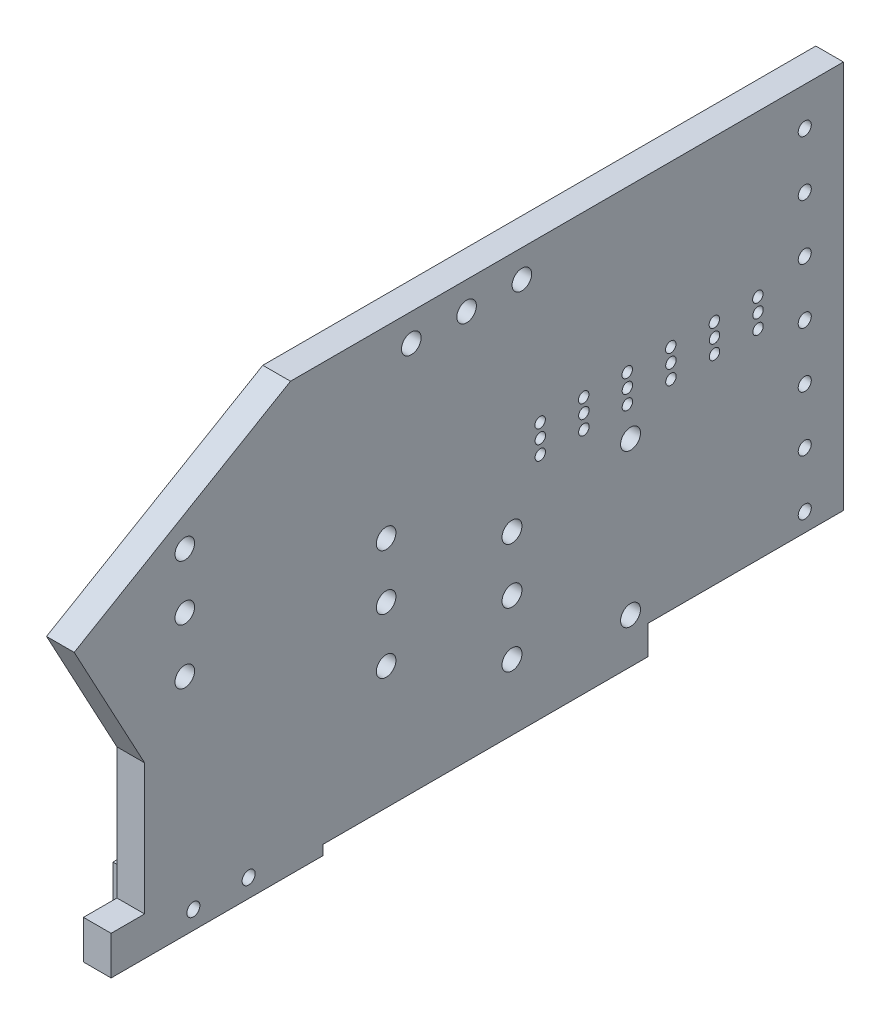
from build123d import *

# Parameters (mm, degrees)
SKETCH2_R           = 1.5
SKETCH2_R_2         = 2.2479
SKETCH2_R_3         = 2.288239151
SKETCH2_R_4         = 2.286
SKETCH2_R_5         = 1.2
BOSS_EXTRUDE3_DEPTH = 6.35
SKETCH2_8_W         = 17.721497707
SKETCH2_8_H         = 5.615097192
BOSS_EXTRUDE7_DEPTH = 11.176
BOSS_EXTRUDE8_DEPTH = 6.35
SKETCH4_R           = 1
CUT_EXTRUDE1_DEPTH  = 1.4224
SKETCH2_10_R        = 1.5
BOSS_EXTRUDE9_DEPTH = 13.97
SKETCH5_R           = 1
CUT_EXTRUDE2_DEPTH  = 0.762
SKETCH5_2_R         = 1
CUT_EXTRUDE3_DEPTH  = 203.558740565
SKETCH4_2_R         = 1
CUT_EXTRUDE4_DEPTH  = 202.480537959


with BuildPart() as part:
    # Sketch2 → Boss-Extrude3 (new body)
    with BuildSketch(Plane(origin=(0, 0, 0), x_dir=(0, 0, -1), z_dir=(1, 0, 0))):
        Polygon((16.17094154, 0), (8.480621378, 0), (8.480621378, -8.89), (57.15, -8.89), (57.15, 0), (176.670010733, 0), (176.670010733, 89.2048), (49.670010733, 89.2048), (0, 60.116195388), (16.17094154, 30.058097694), align=None)
        with Locations((167.780010733, 80.416979557)):
            Circle(SKETCH2_R, mode=Mode.SUBTRACT)
        with Locations((71.642065552, 21.59)):
            Circle(SKETCH2_R_2, mode=Mode.SUBTRACT)
        with Locations((71.642065552, 34.29)):
            Circle(SKETCH2_R_2, mode=Mode.SUBTRACT)
        with Locations((100.543356523, 8.4455)):
            Circle(SKETCH2_R_3, mode=Mode.SUBTRACT)
        with Locations((127.772156523, 3.6703)):
            Circle(SKETCH2_R_4, mode=Mode.SUBTRACT)
        with Locations((167.780010733, 4.216979557)):
            Circle(SKETCH2_R, mode=Mode.SUBTRACT)
        with Locations((100.543356523, 21.1455)):
            Circle(SKETCH2_R_3, mode=Mode.SUBTRACT)
        with Locations((100.543356523, 33.8455)):
            Circle(SKETCH2_R_3, mode=Mode.SUBTRACT)
        with Locations((127.772156523, 38.7223)):
            Circle(SKETCH2_R_4, mode=Mode.SUBTRACT)
        with Locations((167.780010733, 16.916979557)):
            Circle(SKETCH2_R, mode=Mode.SUBTRACT)
        with Locations((167.780010733, 29.616979557)):
            Circle(SKETCH2_R, mode=Mode.SUBTRACT)
        with Locations((25.4, 42.6212)):
            Circle(SKETCH2_R_2, mode=Mode.SUBTRACT)
        with Locations((25.4, 55.3212)):
            Circle(SKETCH2_R_2, mode=Mode.SUBTRACT)
        with Locations((71.642065552, 46.99)):
            Circle(SKETCH2_R_2, mode=Mode.SUBTRACT)
        with Locations((25.4, 68.0212)):
            Circle(SKETCH2_R_2, mode=Mode.SUBTRACT)
        with Locations((77.419204984, 82.8548)):
            Circle(SKETCH2_R_2, mode=Mode.SUBTRACT)
        with Locations((107.050066379, 45.916309191)):
            Circle(SKETCH2_R_5, mode=Mode.SUBTRACT)
        with Locations((107.050066379, 49.192931478)):
            Circle(SKETCH2_R_5, mode=Mode.SUBTRACT)
        with Locations((107.01010757, 52.349677339)):
            Circle(SKETCH2_R_5, mode=Mode.SUBTRACT)
        with Locations((117.050066379, 45.916309191)):
            Circle(SKETCH2_R_5, mode=Mode.SUBTRACT)
        with Locations((127.050066379, 45.916309191)):
            Circle(SKETCH2_R_5, mode=Mode.SUBTRACT)
        with Locations((117.050066379, 49.192931478)):
            Circle(SKETCH2_R_5, mode=Mode.SUBTRACT)
        with Locations((117.01010757, 52.349677339)):
            Circle(SKETCH2_R_5, mode=Mode.SUBTRACT)
        with Locations((127.050066379, 49.192931478)):
            Circle(SKETCH2_R_5, mode=Mode.SUBTRACT)
        with Locations((127.01010757, 52.349677339)):
            Circle(SKETCH2_R_5, mode=Mode.SUBTRACT)
        with Locations((137.050066379, 45.916309191)):
            Circle(SKETCH2_R_5, mode=Mode.SUBTRACT)
        with Locations((147.050066379, 45.916309191)):
            Circle(SKETCH2_R_5, mode=Mode.SUBTRACT)
        with Locations((137.050066379, 49.192931478)):
            Circle(SKETCH2_R_5, mode=Mode.SUBTRACT)
        with Locations((137.01010757, 52.349677339)):
            Circle(SKETCH2_R_5, mode=Mode.SUBTRACT)
        with Locations((147.050066379, 49.192931478)):
            Circle(SKETCH2_R_5, mode=Mode.SUBTRACT)
        with Locations((147.01010757, 52.349677339)):
            Circle(SKETCH2_R_5, mode=Mode.SUBTRACT)
        with Locations((157.050066379, 45.916309191)):
            Circle(SKETCH2_R_5, mode=Mode.SUBTRACT)
        with Locations((167.780010733, 42.316979557)):
            Circle(SKETCH2_R, mode=Mode.SUBTRACT)
        with Locations((157.050066379, 49.192931478)):
            Circle(SKETCH2_R_5, mode=Mode.SUBTRACT)
        with Locations((157.01010757, 52.349677339)):
            Circle(SKETCH2_R_5, mode=Mode.SUBTRACT)
        with Locations((167.780010733, 55.016979557)):
            Circle(SKETCH2_R, mode=Mode.SUBTRACT)
        with Locations((90.119204984, 82.8548)):
            Circle(SKETCH2_R_2, mode=Mode.SUBTRACT)
        with Locations((102.819204984, 82.8548)):
            Circle(SKETCH2_R_2, mode=Mode.SUBTRACT)
        with Locations((167.780010733, 67.716979557)):
            Circle(SKETCH2_R, mode=Mode.SUBTRACT)
        with Locations((40.06885263, -4.684534725)):
            Circle(SKETCH2_R, mode=Mode.SUBTRACT)
        with Locations((27.36885263, -4.684534725)):
            Circle(SKETCH2_R, mode=Mode.SUBTRACT)
    extrude(amount=-BOSS_EXTRUDE3_DEPTH)



with BuildPart() as body_2:
    # Sketch2<8> → Boss-Extrude7 (new body)
    with BuildSketch(Plane(origin=(0, 0, 0), x_dir=(0, 0, -1), z_dir=(1, 0, 0))):
        with Locations((122.876603321, -3.836248596)):
            Rectangle(SKETCH2_8_W, SKETCH2_8_H)
    extrude(amount=-BOSS_EXTRUDE7_DEPTH)


with BuildPart() as part_1:
    add(part.part)

    add(body_2.part)  # Boss-Extrude8 merges body 2
    # Sketch2<9> → Boss-Extrude8 (add)
    with BuildSketch(Plane(origin=(0, 0, 0), x_dir=(0, 0, -1), z_dir=(1, 0, 0))):
        Polygon((57.15, 0), (57.15, -6.643797192), (114.015854467, -6.643797192), (114.015854467, -1.0287), (131.737352174, -1.0287), (131.737352174, 0), align=None)
    extrude(amount=-BOSS_EXTRUDE8_DEPTH)

    # Sketch4 → Cut-Extrude1 (cut)
    with BuildSketch(Plane.XZ.offset(6.643797192)):
        Polygon((-9.232740578, -118.95), (-6.345989232, -118.95), (-4.902613559, -121.45), (-6.345989232, -123.95), (-9.232740578, -123.95), (-10.676116251, -121.45), align=None)
        with Locations((-7.789364905, -121.45)):
            Circle(SKETCH4_R, mode=Mode.SUBTRACT)
    extrude(amount=-CUT_EXTRUDE1_DEPTH, mode=Mode.SUBTRACT)

    # Sketch2<10> → Boss-Extrude9 (add)
    with BuildSketch(Plane(origin=(0, 0, 0), x_dir=(0, 0, -1), z_dir=(1, 0, 0))):
        Polygon((57.15, 0), (22.86, 0), (22.86, -8.89), (57.15, -8.89), (57.15, -6.643797192), align=None)
        with Locations((27.36885263, -4.684534725)):
            Circle(SKETCH2_10_R, mode=Mode.SUBTRACT)
        with Locations((40.06885263, -4.684534725)):
            Circle(SKETCH2_10_R, mode=Mode.SUBTRACT)
    extrude(amount=-BOSS_EXTRUDE9_DEPTH)

    # Sketch5 → Cut-Extrude2 (cut)
    with BuildSketch(Plane.XZ.offset(8.89)):
        Polygon((-10.383375673, -50.2), (-7.496624327, -50.2), (-6.053248654, -52.7), (-7.496624327, -55.2), (-10.383375673, -55.2), (-11.826751346, -52.7), align=None)
        with Locations((-8.94, -52.7)):
            Circle(SKETCH5_R, mode=Mode.SUBTRACT)
    extrude(amount=-CUT_EXTRUDE2_DEPTH, mode=Mode.SUBTRACT)

    # Sketch5<2> → Cut-Extrude3 (cut, through all)
    with BuildSketch(Plane.XZ.offset(8.89)):
        with Locations((-8.94, -52.7)):
            Circle(SKETCH5_2_R)
    extrude(amount=-CUT_EXTRUDE3_DEPTH, mode=Mode.SUBTRACT)

    # Sketch4<2> → Cut-Extrude4 (cut, through all)
    with BuildSketch(Plane.XZ.offset(6.643797192)):
        with Locations((-7.789364905, -121.45)):
            Circle(SKETCH4_2_R)
    extrude(amount=-CUT_EXTRUDE4_DEPTH, mode=Mode.SUBTRACT)


solid = part_1.part
